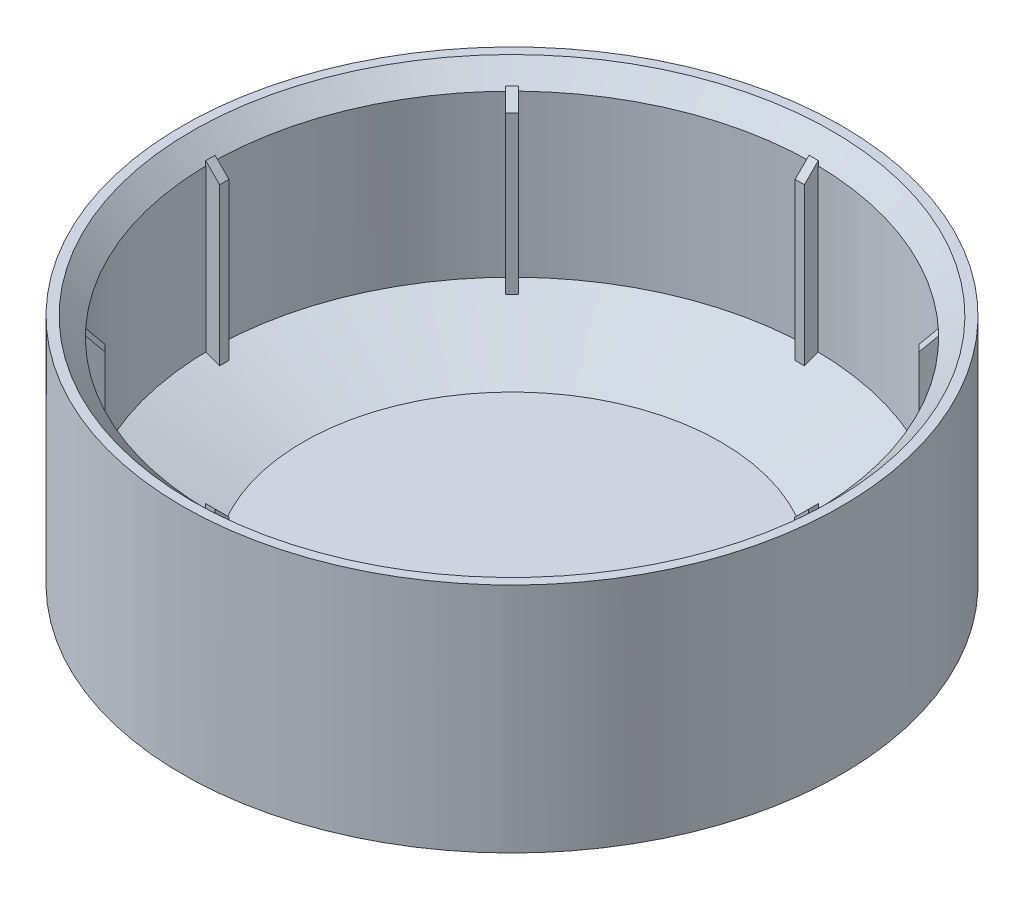
from build123d import *

# Parameters (mm, degrees)
SKETCH1_R           = 35.5
SKETCH1_R_2         = 32.5
BOSS_EXTRUDE1_DEPTH = 20
BOSS_EXTRUDE2_DEPTH = 20
SKETCH3_R           = 31
CUT_EXTRUDE1_DEPTH  = 20
CHAMFER1_SIZE       = 2
CHAMFER2_SIZE       = 3
CHAMFER3_SIZE       = 3
CHAMFER4_SIZE       = 3
CHAMFER5_SIZE       = 3
CHAMFER6_SIZE       = 3
CHAMFER7_SIZE       = 3
CHAMFER8_SIZE       = 3
CHAMFER9_SIZE       = 3
BOSS_EXTRUDE5_START = 3
SKETCH4_R           = 35.5
SKETCH4_R_2         = 32.5
BOSS_EXTRUDE5_DEPTH = 3
BOSS_EXTRUDE6_START = 2
SKETCH5_R           = 35.5
BOSS_EXTRUDE6_DEPTH = 2


with BuildPart() as part:
    # Sketch1 → Boss-Extrude1 (new body)
    with BuildSketch(Plane(origin=(0, 0, 0), x_dir=(1, 0, 0), z_dir=(0, 1, 0))):
        with Locations(Location((0, 0, 0), (0, 0, 270))):
            Circle(SKETCH1_R)
        with Locations(Location((0, 0, 0), (0, 0, 270))):
            Circle(SKETCH1_R_2, mode=Mode.SUBTRACT)
    extrude(amount=BOSS_EXTRUDE1_DEPTH)

    # Chamfer1
    chamfer1_edges = [part.edges().sort_by_distance(p)[0] for p in [
        (0, 20, -32.5),
    ]]
    chamfer(chamfer1_edges, length=CHAMFER1_SIZE)

    # Sketch4 → Boss-Extrude5 (add)
    with BuildSketch(Plane.XZ.offset(BOSS_EXTRUDE5_START)):
        with Locations(Location((0, 0, 0), (0, 0, 270))):
            Circle(SKETCH4_R)
        with Locations(Location((0, 0, 0), (0, 0, 270))):
            Circle(SKETCH4_R_2, mode=Mode.SUBTRACT)
    extrude(amount=-BOSS_EXTRUDE5_DEPTH)

    # Sketch5 → Boss-Extrude6 (add)
    with BuildSketch(Plane.XZ.offset(3).offset(BOSS_EXTRUDE6_START)):
        with Locations(Location((0, 0, 0), (0, 0, 270))):
            Circle(SKETCH5_R)
    extrude(amount=-BOSS_EXTRUDE6_DEPTH)

    # Chamfer10
    # the kernel refuses this chamfer: 10, 3.639702343 mm, written as the material it adds along each edge
    with BuildSketch(Plane(origin=(0, -3, 0), x_dir=(0, 0, -1), z_dir=(-1, 0, 0))) as chamfer10_piece_1:
        with BuildLine():
            Line((32.875877048, -3.7765104), (22.124122952, 0.136808057))
            Line((22.124122952, 0.136808057), (22.124122952, 0.336808057))
            ThreePointArc((22.124122952, 0.336808057), (27.312061476, 0.2), (32.5, 0.2))
            Line((32.5, 0.2), (32.7, 0))
            ThreePointArc((32.7, 0), (32.7, -1.8882552), (33.075877048, -3.7765104))
            Line((33.075877048, -3.7765104), (32.875877048, -3.7765104))
        make_face()
    revolve(axis=Axis((0, -3, 0), (0, -1, 0)))


with BuildPart() as body_2:
    # Sketch2 → Boss-Extrude2 (new body)
    with BuildSketch(Plane(origin=(0, 20, 0), x_dir=(1, 0, 0), z_dir=(0, 1, 0))):
        Polygon((22.624697196, 23.331803977), (0.5, 1.207106781), (0.5, 32.496153619), (-0.5, 32.496153619), (-0.5, 1.207106781), (-22.624697196, 23.331803977), (-23.331803977, 22.624697196), (-1.207106781, 0.5), (-32.496153619, 0.5), (-32.496153619, -0.5), (-1.207106781, -0.5), (-23.331803977, -22.624697196), (-22.624697196, -23.331803977), (-0.5, -1.207106781), (-0.5, -32.496153619), (0.5, -32.496153619), (0.5, -1.207106781), (22.624697196, -23.331803977), (23.331803977, -22.624697196), (1.207106781, -0.5), (32.495485798, -0.541666667), (32.496153619, 0.5), (1.207106781, 0.5), (23.331803977, 22.624697196), align=None)
    extrude(amount=-BOSS_EXTRUDE2_DEPTH)

    # Sketch3 → Cut-Extrude1 (cut)
    with BuildSketch(Plane(origin=(0, 20, 0), x_dir=(1, 0, 0), z_dir=(0, 1, 0))):
        Circle(SKETCH3_R)
    extrude(amount=-CUT_EXTRUDE1_DEPTH, mode=Mode.SUBTRACT)


with BuildPart() as cut_extrude1_piece_1:
    # of the separate pieces the step leaves, piece 1, a body of its own (cut_extrude1_pieces)
    add(body_2.part.solids().sort_by_distance((32.496153619, 20, -0.5))[0])

    # Chamfer4
    # the kernel refuses this chamfer: 3 mm, written as the material it takes off along each edge
    with BuildSketch(Plane(origin=(0, 20, 0), x_dir=(0.9650918920852939, 0, -0.26191151145229885), z_dir=(-0.26191151145229885, 0, -0.9650918920852939))) as chamfer4_piece_1:
        Polygon((31 + CHAMFER4_SIZE, 0), (31, CHAMFER4_SIZE), (31, 0), align=None)
    revolve(axis=Axis((0, 20, 0), (0, -1, 0)), revolution_arc=30.440357856, mode=Mode.SUBTRACT)


with BuildPart() as cut_extrude1_piece_2:
    # of the separate pieces the step leaves, piece 2, a body of its own (cut_extrude1_pieces)
    add(body_2.part.solids().sort_by_distance((23.331803977, 20, 22.624697196))[0])

    # Chamfer5
    # the kernel refuses this chamfer: 3 mm, written as the material it takes off along each edge
    with BuildSketch(Plane(origin=(0, 20, 0), x_dir=(0.4972236185024376, 0, 0.8676224254843476), z_dir=(-0.8676224254843476, 0, 0.4972236185024376))) as chamfer5_piece_1:
        Polygon((31 + CHAMFER5_SIZE, 0), (31, -CHAMFER5_SIZE), (31, 0), align=None)
    revolve(axis=Axis((0, 20, 0), (0, 1, 0)), revolution_arc=30.367029113, mode=Mode.SUBTRACT)


with BuildPart() as cut_extrude1_piece_3:
    # of the separate pieces the step leaves, piece 3, a body of its own (cut_extrude1_pieces)
    add(body_2.part.solids().sort_by_distance((-21.563905404, 20, -22.271012185))[0])

    # Chamfer9
    # the kernel refuses this chamfer: 3 mm, written as the material it takes off along each edge
    with BuildSketch(Plane(origin=(0, 20, 0), x_dir=(-0.4972236185024667, 0, -0.867622425484331), z_dir=(0.867622425484331, 0, -0.4972236185024667))) as chamfer9_piece_1:
        Polygon((31 + CHAMFER9_SIZE, 0), (31, -CHAMFER9_SIZE), (31, 0), align=None)
    revolve(axis=Axis((0, 20, 0), (0, 1, 0)), revolution_arc=30.367029113, mode=Mode.SUBTRACT)


with BuildPart() as cut_extrude1_piece_4:
    # of the separate pieces the step leaves, piece 4, a body of its own (cut_extrude1_pieces)
    add(body_2.part.solids().sort_by_distance((-30.99596748, 20, -0.5))[0])

    # Chamfer8
    # the kernel refuses this chamfer: 3 mm, written as the material it takes off along each edge
    with BuildSketch(Plane(origin=(0, 20, 0), x_dir=(-0.965091892978687, 0, -0.2619115081603219), z_dir=(0.2619115081603219, 0, -0.965091892978687))) as chamfer8_piece_1:
        Polygon((31 + CHAMFER8_SIZE, 0), (31, -CHAMFER8_SIZE), (31, 0), align=None)
    revolve(axis=Axis((0, 20, 0), (0, 1, 0)), revolution_arc=30.367029113, mode=Mode.SUBTRACT)


with BuildPart() as cut_extrude1_piece_5:
    # of the separate pieces the step leaves, piece 5, a body of its own (cut_extrude1_pieces)
    add(body_2.part.solids().sort_by_distance((0.5, 20, -30.99596748))[0])

    # Chamfer2
    # the kernel refuses this chamfer: 3 mm, written as the material it takes off along each edge
    with BuildSketch(Plane(origin=(0, 20, 0), x_dir=(0.26191150816029163, 0, -0.9650918929786952), z_dir=(0.9650918929786952, 0, 0.26191150816029163))) as chamfer2_piece_1:
        Polygon((31 + CHAMFER2_SIZE, 0), (31, -CHAMFER2_SIZE), (31, 0), align=None)
    revolve(axis=Axis((0, 20, 0), (0, 1, 0)), revolution_arc=30.367029113, mode=Mode.SUBTRACT)


with BuildPart() as cut_extrude1_piece_6:
    # of the separate pieces the step leaves, piece 6, a body of its own (cut_extrude1_pieces)
    add(body_2.part.solids().sort_by_distance((0.5, 20, 32.496153619))[0])

    # Chamfer6
    # the kernel refuses this chamfer: 3 mm, written as the material it takes off along each edge
    with BuildSketch(Plane(origin=(0, 20, 0), x_dir=(-0.26191150816025044, 0, 0.9650918929787065), z_dir=(-0.9650918929787065, 0, -0.26191150816025044))) as chamfer6_piece_1:
        Polygon((31 + CHAMFER6_SIZE, 0), (31, -CHAMFER6_SIZE), (31, 0), align=None)
    revolve(axis=Axis((0, 20, 0), (0, 1, 0)), revolution_arc=30.367029113, mode=Mode.SUBTRACT)


with BuildPart() as cut_extrude1_piece_7:
    # of the separate pieces the step leaves, piece 7, a body of its own (cut_extrude1_pieces)
    add(body_2.part.solids().sort_by_distance((-22.271012185, 20, 21.563905404))[0])

    # Chamfer7
    # the kernel refuses this chamfer: 3 mm, written as the material it takes off along each edge
    with BuildSketch(Plane(origin=(0, 20, 0), x_dir=(-0.867622425484322, 0, 0.49722361850248237), z_dir=(-0.49722361850248237, 0, -0.867622425484322))) as chamfer7_piece_1:
        Polygon((31 + CHAMFER7_SIZE, 0), (31, -CHAMFER7_SIZE), (31, 0), align=None)
    revolve(axis=Axis((0, 20, 0), (0, 1, 0)), revolution_arc=30.367029113, mode=Mode.SUBTRACT)


with BuildPart() as cut_extrude1_piece_8:
    # of the separate pieces the step leaves, piece 8, a body of its own (cut_extrude1_pieces)
    add(body_2.part.solids().sort_by_distance((22.624697196, 20, -23.331803977))[0])

    # Chamfer3
    # the kernel refuses this chamfer: 3 mm, written as the material it takes off along each edge
    with BuildSketch(Plane(origin=(0, 20, 0), x_dir=(0.8676224254843233, 0, -0.49722361850248004), z_dir=(0.49722361850248004, 0, 0.8676224254843233))) as chamfer3_piece_1:
        Polygon((31, -CHAMFER3_SIZE), (31 + CHAMFER3_SIZE, 0), (31, 0), align=None)
    revolve(axis=Axis((0, 20, 0), (0, 1, 0)), revolution_arc=30.367029113, mode=Mode.SUBTRACT)


solid = Compound([part.part, cut_extrude1_piece_1.part, cut_extrude1_piece_2.part, cut_extrude1_piece_3.part, cut_extrude1_piece_4.part, cut_extrude1_piece_5.part, cut_extrude1_piece_6.part, cut_extrude1_piece_7.part, cut_extrude1_piece_8.part])
